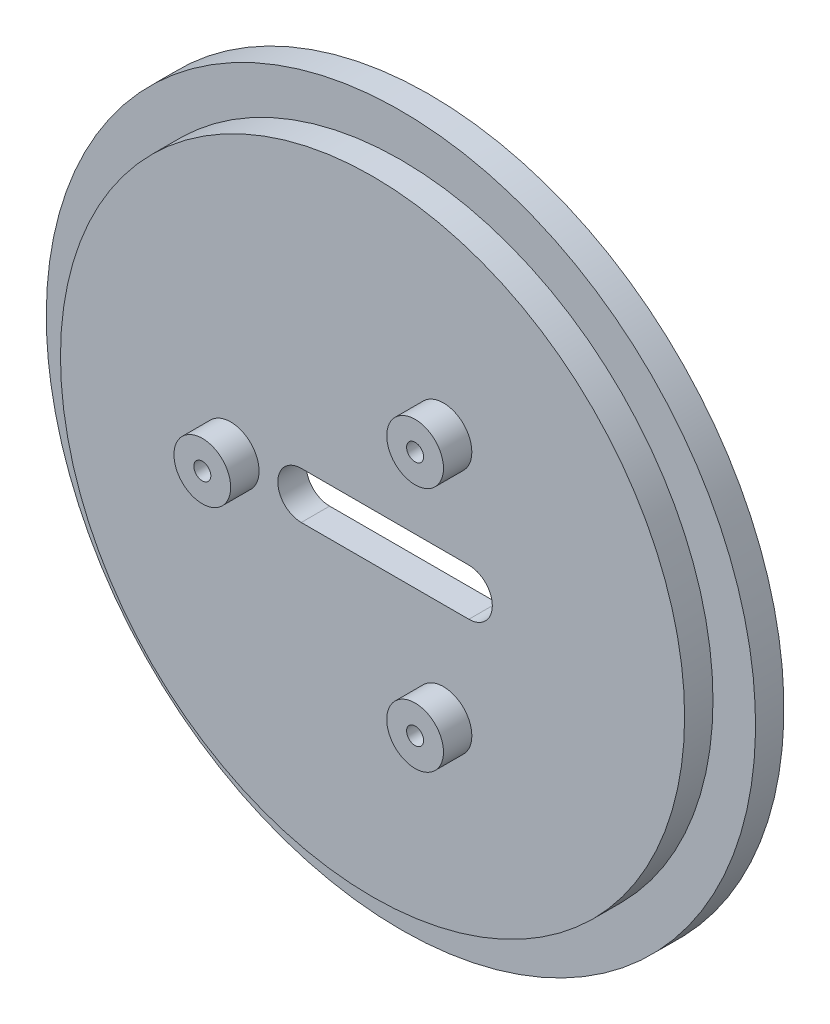
from build123d import *

# Parameters (mm, degrees)
SKETCH_1_R          = 22
EXTRUDE_1_DEPTH     = 2
SKETCH_2_R          = 2
SKETCH_2_R_2        = 0.6
EXTRUDE_2_DEPTH     = 4
SKETCH_3_R          = 25
EXTRUDE_3_DEPTH     = 2
CUT_EXTRUDE_1_DEPTH = 2
CUT_EXTRUDE_2_DEPTH = 1
SKETCH_6_R          = 5.45
SKETCH_6_R_2        = 3.85
CUT_EXTRUDE_3_DEPTH = 1.3
CUT_EXTRUDE_START   = -18.5
SKETCH_8_R          = 0.6
CUT_EXTRUDE_4_DEPTH = 18.5
SKETCH_9_R          = 16.695755265
CUT_EXTRUDE_5_DEPTH = 2
SKETCH_10_R         = 1.6
CUT_EXTRUDE_6_DEPTH = 1
SKETCH_11_R         = 1.6
CUT_EXTRUDE_7_DEPTH = 3
CUT_EXTRUDE_8_DEPTH = 10


with BuildPart() as part:
    # 草图1 → 凸台-拉伸1 (new body)
    with BuildSketch(Plane.XY):
        Circle(SKETCH_1_R)
    extrude(amount=EXTRUDE_1_DEPTH)

    # 草图2 → 凸台-拉伸2 (add)
    # profile 1 of 3: a face of its own
    with BuildSketch(Plane.XY.offset(2)):
        with Locations((-10, 0)):
            Circle(SKETCH_2_R)
        with Locations((-10, 0)):
            Circle(SKETCH_2_R_2, mode=Mode.SUBTRACT)
    # profile 2 of 3: a face of its own
    with BuildSketch(Plane.XY.offset(2)):
        with Locations((5, 8.660254038)):
            Circle(SKETCH_2_R)
        with Locations((5, 8.660254038)):
            Circle(SKETCH_2_R_2, mode=Mode.SUBTRACT)
    # profile 3 of 3: a face of its own
    with BuildSketch(Plane.XY.offset(2)):
        with Locations((5, -8.660254038)):
            Circle(SKETCH_2_R)
        with Locations((5, -8.660254038)):
            Circle(SKETCH_2_R_2, mode=Mode.SUBTRACT)
    extrude(amount=EXTRUDE_2_DEPTH)

    # 草图3 → 凸台-拉伸3 (add)
    with BuildSketch(Plane(origin=(0, 0, 0), x_dir=(-1, 0, 0), z_dir=(0, 0, -1))):
        Circle(SKETCH_3_R)
    extrude(amount=EXTRUDE_3_DEPTH)

    # 草图4 → 切除-拉伸1 (cut)
    with BuildSketch(Plane(origin=(0, 0, -2), x_dir=(-1, 0, 0), z_dir=(0, 0, -1))):
        with BuildLine():
            Line((-7.25, 3.95), (7.25, 3.95))
            ThreePointArc((7.25, 3.95), (11.2, 0), (7.25, -3.95))
            Line((7.25, -3.95), (-7.25, -3.95))
            ThreePointArc((-7.25, -3.95), (-11.2, 0), (-7.25, 3.95))
        make_face()
    extrude(amount=-CUT_EXTRUDE_1_DEPTH, mode=Mode.SUBTRACT)

    # 草图5 → 切除-拉伸2 (cut)
    with BuildSketch(Plane(origin=(0, 0, -2), x_dir=(-1, 0, 0), z_dir=(0, 0, -1))):
        Polygon((21, -3.95), (21, -4), (29.149006969, -4), (29.149006969, 4), (21, 4), align=None)
    extrude(amount=-CUT_EXTRUDE_2_DEPTH, mode=Mode.SUBTRACT)

    # 草图6 → 切除-拉伸3 (cut)
    # profile 1 of 3: a face of its own
    with BuildSketch(Plane(origin=(0, 0, -2), x_dir=(-1, 0, 0), z_dir=(0, 0, -1))):
        with Locations((-18, 0)):
            Circle(SKETCH_6_R)
        with Locations((-18, 0)):
            Circle(SKETCH_6_R_2, mode=Mode.SUBTRACT)
    # profile 2 of 3: a face of its own
    with BuildSketch(Plane(origin=(0, 0, -2), x_dir=(-1, 0, 0), z_dir=(0, 0, -1))):
        with Locations((9, 15.588457268)):
            Circle(SKETCH_6_R)
        with Locations((9, 15.588457268)):
            Circle(SKETCH_6_R_2, mode=Mode.SUBTRACT)
    # profile 3 of 3: a face of its own
    with BuildSketch(Plane(origin=(0, 0, -2), x_dir=(-1, 0, 0), z_dir=(0, 0, -1))):
        with Locations((9, -15.588457268)):
            Circle(SKETCH_6_R)
        with Locations((9, -15.588457268)):
            Circle(SKETCH_6_R_2, mode=Mode.SUBTRACT)
    extrude(amount=-CUT_EXTRUDE_3_DEPTH, mode=Mode.SUBTRACT)

    # 草图8 → 切除-拉伸4 (cut)
    with BuildSketch(Plane.XY.offset(6).offset(CUT_EXTRUDE_START)):
        with Locations((5, -8.660254038)):
            Circle(SKETCH_8_R)
        with Locations((-10, 0)):
            Circle(SKETCH_8_R)
        with Locations((5, 8.660254038)):
            Circle(SKETCH_8_R)
    extrude(amount=CUT_EXTRUDE_4_DEPTH, mode=Mode.SUBTRACT)

    # 草图9 → 切除-拉伸5 (cut)
    with BuildSketch(Plane.XY.offset(6)):
        Circle(SKETCH_9_R)
    extrude(amount=-CUT_EXTRUDE_5_DEPTH, mode=Mode.SUBTRACT)

    # 草图10 → 切除-拉伸6 (cut)
    with BuildSketch(Plane(origin=(0, 0, -2), x_dir=(-1, 0, 0), z_dir=(0, 0, -1))):
        with Locations((-5, -8.660254038)):
            Circle(SKETCH_10_R)
        with Locations((-5, 8.660254038)):
            Circle(SKETCH_10_R)
    extrude(amount=-CUT_EXTRUDE_6_DEPTH, mode=Mode.SUBTRACT)

    # 草图11 → 切除-拉伸7 (cut)
    with BuildSketch(Plane(origin=(0, 0, -2), x_dir=(-1, 0, 0), z_dir=(0, 0, -1))):
        with Locations((10, 0)):
            Circle(SKETCH_11_R)
    extrude(amount=-CUT_EXTRUDE_7_DEPTH, mode=Mode.SUBTRACT)

    # 草图12 → 切除-拉伸8 (cut)
    with BuildSketch(Plane(origin=(0, 0, 0), x_dir=(-1, 0, 0), z_dir=(0, 0, -1))):
        with BuildLine():
            Line((5.025725463, -1.652886148), (-6.790280094, -1.652886148))
            ThreePointArc((-6.790280094, -1.652886148), (-8.443166243, 0), (-6.790280094, 1.652886148))
            Line((-6.790280094, 1.652886148), (5.025725463, 1.652886148))
            ThreePointArc((5.025725463, 1.652886148), (6.678611612, 0), (5.025725463, -1.652886148))
        make_face()
    extrude(amount=-CUT_EXTRUDE_8_DEPTH, mode=Mode.SUBTRACT)


solid = part.part
